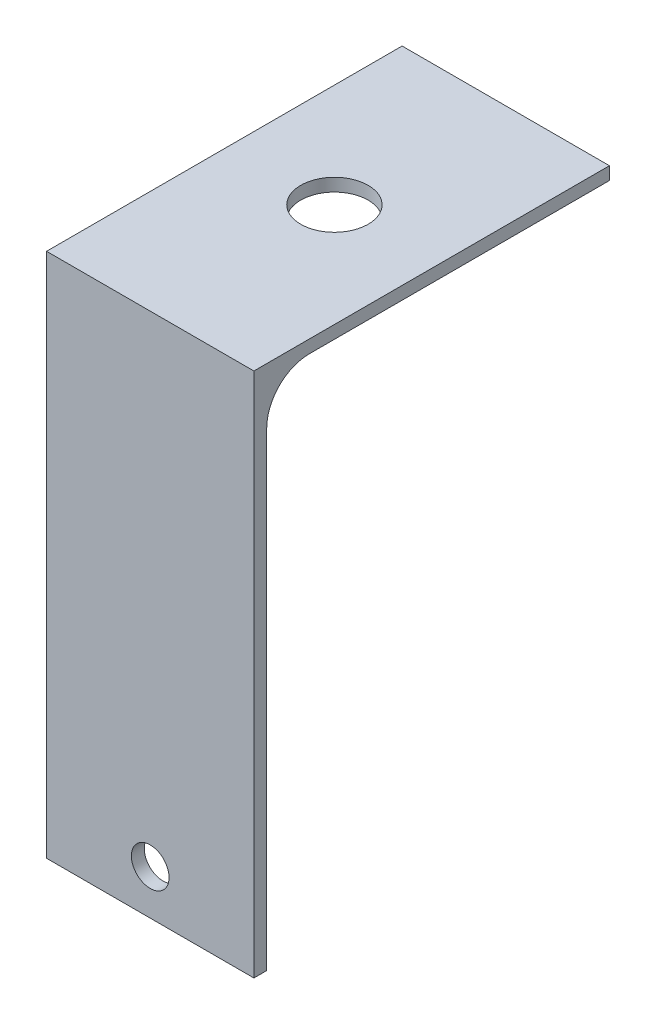
from build123d import *

# Parameters (mm, degrees)
SKETCH1_W           = 24.2
SKETCH1_H           = 61.36
BOSS_EXTRUDE1_DEPTH = 1.5
SKETCH2_R           = 2.2
CUT_EXTRUDE1_DEPTH  = 34.013972799
SKETCH4_W           = 24.2
SKETCH4_H           = 40
BOSS_EXTRUDE2_DEPTH = 1.5
SKETCH5_R           = 3.937
CUT_EXTRUDE2_DEPTH  = 74.004312201
FILLET1_R           = 5


with BuildPart() as part:
    # Sketch1 → Boss-Extrude1 (new body)
    with BuildSketch(Plane.XY):
        Rectangle(SKETCH1_W, SKETCH1_H)
    extrude(amount=BOSS_EXTRUDE1_DEPTH)

    # Sketch2 → Cut-Extrude1 (cut, through all)
    with BuildSketch(Plane.XY.offset(1.5)):
        with Locations((0, -25.48)):
            Circle(SKETCH2_R)
    extrude(amount=-CUT_EXTRUDE1_DEPTH, mode=Mode.SUBTRACT)

    # Sketch4 → Boss-Extrude2 (add)
    with BuildSketch(Plane(origin=(0, 30.68, 0), x_dir=(1, 0, 0), z_dir=(0, 1, 0))):
        with Locations((0, 20)):
            Rectangle(SKETCH4_W, SKETCH4_H)
    extrude(amount=-BOSS_EXTRUDE2_DEPTH)

    # Sketch5 → Cut-Extrude2 (cut, through all)
    with BuildSketch(Plane.XZ.offset(-29.18)):
        with Locations((0, -20)):
            Circle(SKETCH5_R)
    extrude(amount=-CUT_EXTRUDE2_DEPTH, mode=Mode.SUBTRACT)

    # Fillet1
    fillet1_edges = [part.edges().sort_by_distance(p)[0] for p in [
        (0, 29.18, 0),
    ]]
    fillet(fillet1_edges, radius=FILLET1_R)


solid = part.part
